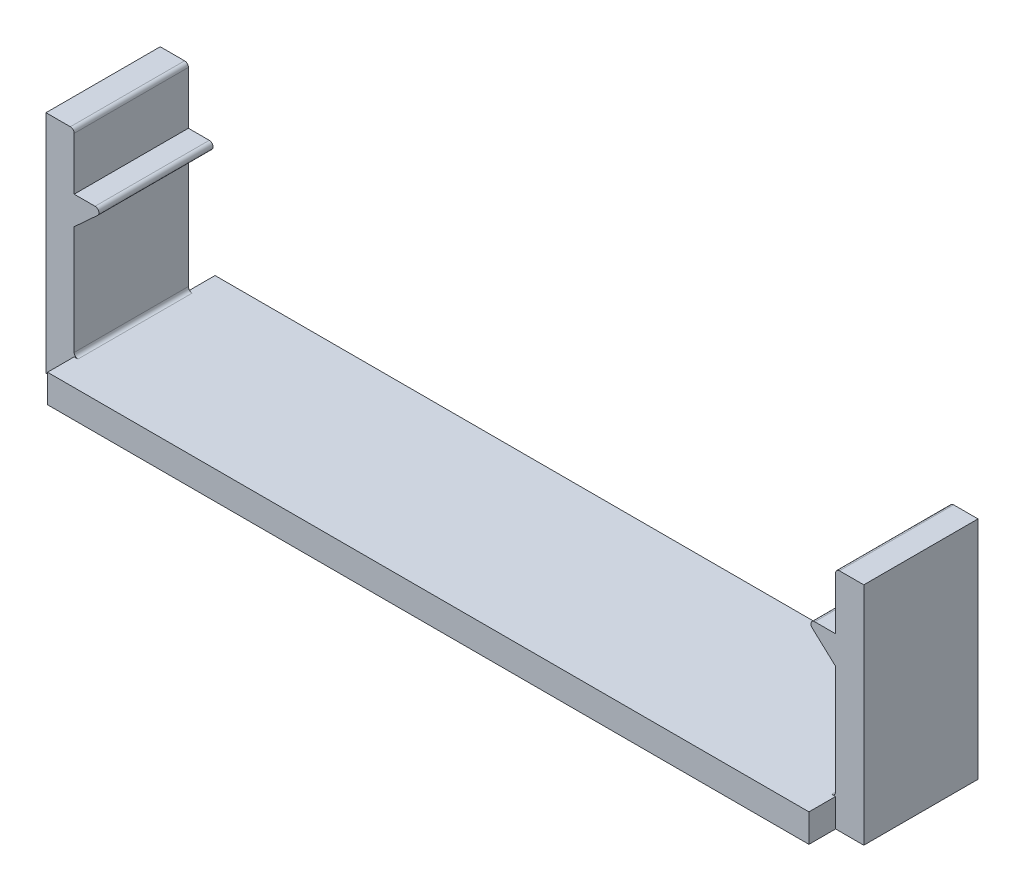
from build123d import *

# Parameters (mm, degrees)
CLIPS_DEPTH             = 1.905
CLIPS_2_DEPTH           = 1.905
BASE_OUTLINE_ADHESIVE_W = 25.4
BASE_OUTLINE_ADHESIVE_H = 0.9398
ADHESIVE_BASE_DEPTH     = 2.794
FILLET2_R               = 0.127


with BuildPart() as part:
    # Clips Outline → Clips (new, symmetric)
    with BuildSketch(Plane.XY):
        Polygon((12.7, 3.7592), (11.676950897, 4.699), (12.7, 4.699), (12.7, 6.58368), (13.6398, 6.58368), (13.6398, -0.9398), (12.7, -0.9398), (12.7, 0), align=None)
    extrude(amount=CLIPS_DEPTH, both=True)



with BuildPart() as body_2:
    # Clips Outline → Clips 2 (new, symmetric)
    with BuildSketch(Plane.XY):
        Polygon((-12.7, 0), (-12.7, 3.7592), (-11.676950897, 4.699), (-12.7, 4.699), (-12.7, 6.58368), (-13.6398, 6.58368), (-13.6398, -0.9398), (-12.7, -0.9398), align=None)
    extrude(amount=CLIPS_2_DEPTH, both=True)


with BuildPart() as part_1:
    add(part.part)

    add(body_2.part)  # Adhesive Base merges body 2
    # Base Outline Adhesive → Adhesive Base (add, symmetric)
    with BuildSketch(Plane.XY):
        with Locations((0, -0.4699)):
            Rectangle(BASE_OUTLINE_ADHESIVE_W, BASE_OUTLINE_ADHESIVE_H)
    extrude(amount=ADHESIVE_BASE_DEPTH, both=True)

    # Fillet2
    fillet2_edges = [part_1.edges().sort_by_distance(p)[0] for p in [
        (12.7, 0, 0),
        (-12.7, 0, 0),
        (12.7, 6.58368, 0),
        (-12.7, 6.58368, 0),
        (11.676950897, 4.699, 0),
        (-11.676950897, 4.699, 0),
    ]]
    fillet(fillet2_edges, radius=FILLET2_R)


solid = part_1.part
